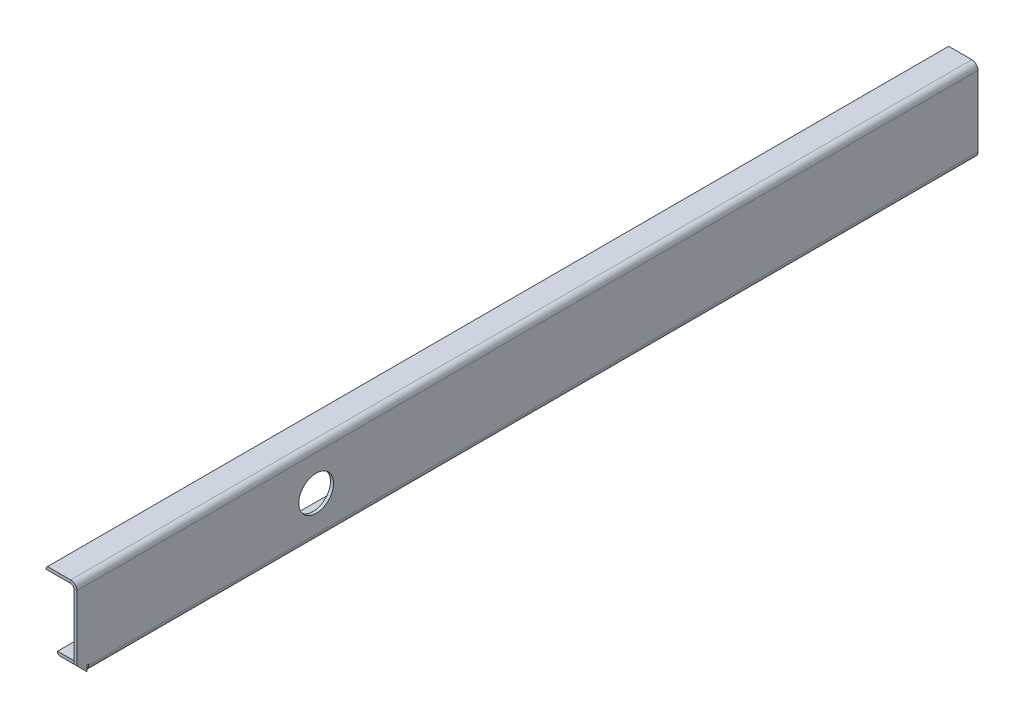
from build123d import *

# Parameters (mm, degrees)
SM_BASE_FLANGE_1_DEPTH             = 8
SM_EDGE_FLANGE_1_STRIP_W           = 48
SM_EDGE_FLANGE_1_STRIP_H           = 8
SM_EDGE_FLANGE_1_STRIP_CUT_DEPTH   = 2335
SM_EDGE_FLANGE_1_STRIP_2_W         = 48
SM_EDGE_FLANGE_1_STRIP_2_H         = 8
SM_EDGE_FLANGE_1_STRIP_CUT_2_DEPTH = 2305
SM_EDGE_FLANGE_1_RELIEF_W          = 52
SM_EDGE_FLANGE_1_RELIEF_H          = 4
SM_EDGE_FLANGE_1_RELIEF_CUT_DEPTH  = 8
SM_EDGE_FLANGE_1_DEPTH             = 2335
SM_EDGE_FLANGE_1_BEND_DEPTH        = 2305
CHAMFER_1_SIZE                     = 4
SKETCH_12_R                        = 45
CUT_EXTRUDE_1_DEPTH                = 2347.241675531


# Sheet-metal steps are written as plain solids
with BuildPart() as part:
    # Sketch 1 → 基体-法兰1 (new body)
    with BuildSketch(Plane(origin=(0, 0, 0), x_dir=(0, 0, -1), z_dir=(1, 0, 0))):
        Polygon((0, 0), (2335, 0), (2335, -215), (30, -215), (0, -185), align=None)
    extrude(amount=-SM_BASE_FLANGE_1_DEPTH)

    # 边线-法兰1 strip (across the edge) → 边线-法兰1 strip cut (cut)
    with BuildSketch(Plane(origin=(-8, 0, 0), x_dir=(0, -1, 0), z_dir=(0, 0, -1))):
        with Locations((-8, -4)):
            Rectangle(SM_EDGE_FLANGE_1_STRIP_W, SM_EDGE_FLANGE_1_STRIP_H)
    extrude(amount=SM_EDGE_FLANGE_1_STRIP_CUT_DEPTH, mode=Mode.SUBTRACT)

    # 边线-法兰1 strip 2 (across the edge) → 边线-法兰1 strip cut 2 (cut)
    with BuildSketch(Plane(origin=(-8, -215, -2335), x_dir=(0, 1, 0), z_dir=(0, 0, 1))):
        with Locations((-8, -4)):
            Rectangle(SM_EDGE_FLANGE_1_STRIP_2_W, SM_EDGE_FLANGE_1_STRIP_2_H)
    extrude(amount=SM_EDGE_FLANGE_1_STRIP_CUT_2_DEPTH, mode=Mode.SUBTRACT)

    # 边线-法兰1 relief (on the sheet) → 边线-法兰1 relief cut (cut)
    with BuildSketch(Plane(origin=(-8, -199, -2335), x_dir=(0, 1, 0), z_dir=(-1, 0, 0))):
        with Locations((-22, -2307)):
            Rectangle(SM_EDGE_FLANGE_1_RELIEF_W, SM_EDGE_FLANGE_1_RELIEF_H)
    extrude(amount=-SM_EDGE_FLANGE_1_RELIEF_CUT_DEPTH, mode=Mode.SUBTRACT)

    # 边线-法兰1 section (across the edge) → 边线-法兰1 (add)
    with BuildSketch(Plane(origin=(-8, 0, 0), x_dir=(0, -1, 0), z_dir=(0, 0, -1))):
        with BuildLine():
            Line((0, 8), (0, 72))
            Line((0, 72), (8, 72))
            Line((8, 72), (8, 8))
            ThreePointArc((8, 8), (10.343145751, 2.343145751), (16, 0))
            Line((16, 0), (16, -8))
            ThreePointArc((16, -8), (4.686291501, -3.313708499), (0, 8))
        make_face()
    extrude(amount=SM_EDGE_FLANGE_1_DEPTH)

    # 边线-法兰1 section 2 (across the edge) → 边线-法兰1 bend (add)
    with BuildSketch(Plane(origin=(-8, -215, -2335), x_dir=(0, 1, 0), z_dir=(0, 0, 1))):
        with BuildLine():
            Line((0, 8), (0, 72))
            Line((0, 72), (8, 72))
            Line((8, 72), (8, 8))
            ThreePointArc((8, 8), (10.343145751, 2.343145751), (16, 0))
            Line((16, 0), (16, -8))
            ThreePointArc((16, -8), (4.686291501, -3.313708499), (0, 8))
        make_face()
    extrude(amount=SM_EDGE_FLANGE_1_BEND_DEPTH)

    # 倒角1
    chamfer_1_edges = [part.edges().sort_by_distance(p)[0] for p in [
        (-80, 0, -1167.5),
        (-80, -215, -1182.5),
    ]]
    chamfer(chamfer_1_edges, length=CHAMFER_1_SIZE)

    # 草图12 → 切除-拉伸1 (cut, through all)
    with BuildSketch(Plane(origin=(0, 0, 0), x_dir=(0, 0, -1), z_dir=(1, 0, 0))):
        with Locations((620, -107.5)):
            Circle(SKETCH_12_R)
    extrude(amount=-CUT_EXTRUDE_1_DEPTH, mode=Mode.SUBTRACT)


solid = part.part
